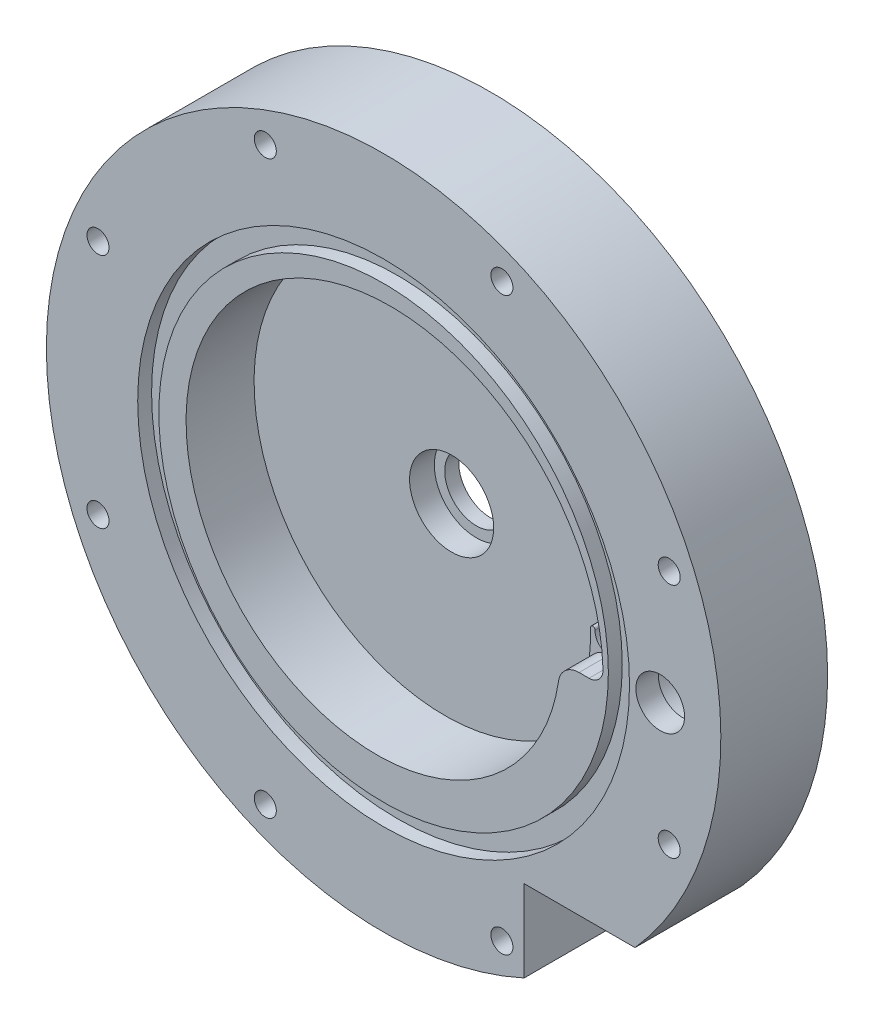
from build123d import *

# Parameters (mm, degrees)
VOLUTE_CUT_DEPTH         = 109.853225441
CAP_CUT_DEPTH            = 110.150134912
SKETCH28_W               = 25.046126628
SKETCH28_H               = 18.470321928
OUTLET_HOLE_CUT_DEPTH    = 111.431593896
OUTLET_PIPE_THREAD_D     = 14.2748
OUTLET_PIPE_THREAD_DEPTH = 12.7
OUTLET_PIPE_THREAD_TIP   = 4.288582582
SKETCH26_R               = 2.4892
FASTENER_HOLE_DEPTH      = 111.431593896
FASTENER_HOLES_COUNT     = 8
SKETCH16_R               = 55.5625
SKETCH16_R_2             = 50.7873
O_RING_GROOVE_DEPTH      = 3.1369
CIRPATTERN1_COUNT        = 8


with BuildPart() as part:
    # Sketch22 → Main Body (revolve)
    with BuildSketch(Plane(origin=(0, 0, 0), x_dir=(1, 0, 0), z_dir=(0, 1, 0))):
        Polygon((-25.4, 0), (-9.5, 0), (-9.5, 5.588), (-7.14375, 5.588), (-7.14375, 8.763), (-76.2, 8.763), (-76.2, -15.367), (-25.4, -15.367), align=None)
    revolve(axis=Axis((0, 0, 0), (0, 0, -1)))

    # Sketch23 → Volute Cut (cut, through all)
    with BuildSketch(Plane.XY):
        with BuildLine():
            Line((44.166924028, -3.278948669), (46.409987281, -3.278948669))
            ThreePointArc((46.409987281, -3.278948669), (48.689668065, -2.311613487), (49.577995098, 0))
            add(Edge.make_bspline(
                [(39.939526111, 0), (39.942269446, -0.0837473), (39.947756723, -0.251260409), (39.954015699, -0.502616311), (39.958818633, -0.754058522), (39.965227666, -1.257271925), (39.961619732, -2.517021244), (39.875091851, -4.365243066), (39.649454652, -6.542756078), (39.33988264, -8.543760179), (38.929454388, -10.530211789), (38.418824768, -12.497026639), (37.808911738, -14.439148731), (37.100892119, -16.351564673), (36.296198826, -18.22931668), (35.396517359, -20.067515799), (34.403782101, -21.86135476), (33.320172005, -23.606120692), (32.148105775, -25.297207577), (30.890236459, -26.930128476), (29.549445458, -28.500527466), (28.128835965, -30.00419128), (26.631725823, -31.437060619), (25.061639825, -32.795241099), (23.422301466, -34.075013818), (21.717624168, -35.272845505), (19.951701985, -36.385398236), (18.128799822, -37.409538673), (16.253343185, -38.342346824), (14.329907485, -39.18112428), (12.363206918, -39.923401923), (10.358082955, -40.566947066), (8.319492465, -41.109770024), (6.2524955, -41.550130082), (4.162242776, -41.886540847), (2.053962868, -42.117774975), (-0.06705083, -42.242868254), (-2.195453363, -42.261123016), (-4.325861655, -42.172110902), (-6.452868085, -41.975674931), (-8.57105419, -41.671930888), (-10.675004435, -41.261268029), (-12.759320026, -40.744349078), (-14.818632734, -40.12210953), (-16.847618693, -39.395756259), (-18.841012126, -38.56676542), (-20.793618979, -37.636879662), (-22.700330424, -36.608104648), (-24.556136184, -35.482704889), (-26.356137661, -34.263198905), (-28.095560825, -32.952353715), (-29.769768833, -31.55317868), (-31.374274336, -30.068918699), (-32.904751456, -28.503046779), (-34.357047394, -26.859256), (-35.727193628, -25.141450883), (-37.011416693, -23.353738194), (-38.206148494, -21.500417195), (-39.308036131, -19.585969367), (-40.313951213, -17.615047632), (-41.220998633, -15.592465105), (-42.026524769, -13.523183384), (-42.728125112, -11.412300433), (-43.323651272, -9.265038062), (-43.811217363, -7.086729057), (-44.189205737, -4.882803972), (-44.45627205, -2.658777629), (-44.611349658, -0.420235354), (-44.653653307, 1.827181013), (-44.582682128, 4.077787306), (-44.398221909, 6.325871377), (-44.100346646, 8.56570756), (-43.689419363, 10.791571224), (-43.166092199, 12.997753372), (-42.531305754, 15.17857525), (-41.786287694, 17.328402935), (-40.932550626, 19.441661853), (-39.971889229, 21.5128512), (-38.906376662, 23.536558227), (-37.738360243, 25.507472342), (-36.470456415, 27.420399009), (-35.105545007, 29.270273394), (-33.646762806, 31.052173728), (-32.097496441, 32.761334351), (-30.461374618, 34.393158406), (-28.742259697, 35.943230135), (-26.94423865, 37.407326771), (-25.071613414, 38.781429964), (-23.128890663, 40.061736735), (-21.120771014, 41.244669906), (-19.052137713, 42.326888003), (-16.928044805, 43.305294581), (-14.753704833, 44.177046957), (-12.534476089, 44.939564331), (-10.275849449, 45.590535256), (-7.983434825, 46.127924454), (-5.662947262, 46.549978947), (-3.32019273, 46.855233489), (-0.961053623, 47.042515279), (1.408525976, 47.110947946), (3.782555248, 47.059954789), (6.155011749, 46.889261268), (8.519856664, 46.598896718), (10.871050148, 46.189195315), (13.202566726, 45.660796242), (15.5084107, 45.014643097), (17.782631543, 44.251982509), (20.019339221, 43.374361984), (22.21271942, 42.383626969), (24.357048618, 41.281917146), (26.446708992, 40.07166197), (28.476203094, 38.755575441), (30.440168269, 37.336650139), (32.333390787, 35.818150527), (34.150819627, 34.203605534), (35.887579905, 32.496800442), (37.53898589, 30.70176809), (39.100553583, 28.822779415), (40.568012821, 26.864333353), (41.937318874, 24.831146131), (43.204663511, 22.728139958), (44.366485495, 20.560431162), (45.419480476, 18.333317788), (46.360610274, 16.052266689), (47.187111503, 13.722900146), (47.896503526, 11.35098205), (48.486595709, 8.942403666), (48.955493971, 6.503169041), (49.272698681, 4.245159804), (49.431000562, 2.592939581), (49.496684411, 1.660906774), (49.521980456, 1.24612125), (49.539009606, 0.934823446), (49.554044624, 0.6233596), (49.56726265, 0.311747828), (49.574417371, 0.103923043), (49.577995098, 0)],
                knots=[0, 0, 0, 0, 0.000895368, 0.001790933, 0.002686696, 0.003582656, 0.00716847, 0.016146863, 0.023343889, 0.030553689, 0.037776306, 0.045011781, 0.052260149, 0.059521445, 0.0667957, 0.074082946, 0.08138321, 0.088696521, 0.096022905, 0.103362389, 0.110714996, 0.11808075, 0.125459676, 0.132851796, 0.140257131, 0.147675704, 0.155107535, 0.162552646, 0.170011055, 0.177482784, 0.184967851, 0.192466275, 0.199978075, 0.207503269, 0.215041875, 0.222593912, 0.230159396, 0.237738345, 0.245330775, 0.252936704, 0.260556148, 0.268189123, 0.275835645, 0.28349573, 0.291169394, 0.298856653, 0.306557521, 0.314272014, 0.322000147, 0.329741934, 0.337497391, 0.345266532, 0.35304937, 0.360845922, 0.368656199, 0.376480218, 0.384317991, 0.392169531, 0.400034854, 0.407913972, 0.415806898, 0.423713647, 0.43163423, 0.439568662, 0.447516954, 0.455479121, 0.463455174, 0.471445127, 0.479448991, 0.48746678, 0.495498506, 0.503544181, 0.511603818, 0.519677428, 0.527765023, 0.535866616, 0.543982219, 0.552111843, 0.5602555, 0.568413202, 0.57658496, 0.584770787, 0.592970693, 0.60118469, 0.609412789, 0.617655002, 0.625911339, 0.634181813, 0.642466433, 0.650765212, 0.65907816, 0.667405288, 0.675746607, 0.684102128, 0.692471861, 0.700855818, 0.709254008, 0.717666443, 0.726093134, 0.734534089, 0.742989321, 0.75145884, 0.759942655, 0.768440778, 0.776953218, 0.785479986, 0.794021092, 0.802576546, 0.811146358, 0.819730538, 0.828329097, 0.836942043, 0.845569388, 0.854211141, 0.862867312, 0.87153791, 0.880222946, 0.888922429, 0.89763637, 0.906364776, 0.915107659, 0.923865028, 0.932636892, 0.94142326, 0.950224144, 0.959039551, 0.967869491, 0.976713973, 0.985573008, 0.992226839, 0.994446604, 0.995556828, 0.996667279, 0.997777958, 0.998888865, 1, 1, 1, 1], degree=3))
            ThreePointArc((39.939526111, 0), (40.466576111, 0.544597432), (40.993626111, 0))
            ThreePointArc((40.993626111, 0), (41.885404576, -2.31195546), (44.166924028, -3.278948669))
        make_face()
    extrude(amount=VOLUTE_CUT_DEPTH, mode=Mode.SUBTRACT)

    # Sketch25 → Cap Cut (cut, through all)
    with BuildSketch(Plane.XY.offset(8.58266)):
        with BuildLine():
            ThreePointArc((39.530232145, -7.279976568), (41.104770543, -4.417482526), (44.166924028, -3.278948669))
            ThreePointArc((44.166924028, -3.278948669), (41.885404576, -2.31195546), (40.993626111, 0))
            ThreePointArc((40.993626111, 0), (40.466576111, 0.544597432), (39.939526111, 0))
            add(Edge.make_bspline(
                [(39.530232145, -7.279976568), (39.566715351, -7.033442985), (39.69332497, -6.119385335), (39.875091851, -4.365243066), (39.961619732, -2.517021244), (39.965227666, -1.257271925), (39.958818633, -0.754058522), (39.954015699, -0.502616311), (39.947756723, -0.251260409), (39.942269446, -0.0837473), (39.939526111, 0)],
                knots=[0.973993066, 0.973993066, 0.973993066, 0.973993066, 0.976656111, 0.983853137, 0.99283153, 0.996417344, 0.997313304, 0.998209067, 0.999104632, 1, 1, 1, 1], degree=3))
        make_face()
    extrude(amount=CAP_CUT_DEPTH, mode=Mode.SUBTRACT)

    # Sketch28 → Outlet Hole Cut (cut, through all)
    with BuildSketch(Plane.XY.offset(15.367)):
        with Locations((44.273063314, -60.035160964)):
            Rectangle(SKETCH28_W, SKETCH28_H)
    extrude(amount=-OUTLET_HOLE_CUT_DEPTH, mode=Mode.SUBTRACT)

    # Sketch20 → Outlet Hole (revolve, cut)
    with BuildSketch(Plane(origin=(45.288455655, -50.8, 4.29133), x_dir=(0, 0, -1), z_dir=(1, 0, 0))):
        Polygon((0, 0), (0, 53.661598698), (4.7625, 50.8), (4.7625, 0), align=None)
    revolve(axis=Axis((45.288455655, -57.15, 4.29133), (0, 1, 0)), mode=Mode.SUBTRACT)

    # Outlet Pipe Thread
    with Locations(Plane(origin=(45.288455655, -50.8, 4.29133), x_dir=(0, 0, -1), z_dir=(0, -1, 0))):
        with Locations((0, 0)):
            Hole(OUTLET_PIPE_THREAD_D / 2, depth=OUTLET_PIPE_THREAD_DEPTH)
            with Locations((0, 0, -(OUTLET_PIPE_THREAD_DEPTH + OUTLET_PIPE_THREAD_TIP / 2))):  # 118° drill point
                Cone(0, OUTLET_PIPE_THREAD_D / 2, OUTLET_PIPE_THREAD_TIP, mode=Mode.SUBTRACT)

    # Sketch26 → Fastener Hole (cut, through all)
    with BuildSketch(Plane.XY.offset(15.367)):
        with Locations((64.532985346, -26.730437751)):
            Circle(SKETCH26_R)
    fastener_hole = extrude(amount=-FASTENER_HOLE_DEPTH, mode=Mode.SUBTRACT)

    # Fastener Holes: Fastener Hole ×8 about axis
    fastener_holes_axis = Axis((0, 0, 0), (0, 0, 1))
    for i in range(1, FASTENER_HOLES_COUNT):
        add(fastener_hole.rotate(fastener_holes_axis, i * 360 / FASTENER_HOLES_COUNT), mode=Mode.SUBTRACT)

    # Sketch16 → O-Ring Groove (cut)
    with BuildSketch(Plane.XY.offset(15.367)):
        Circle(SKETCH16_R)
        Circle(SKETCH16_R_2, mode=Mode.SUBTRACT)
    extrude(amount=-O_RING_GROOVE_DEPTH, mode=Mode.SUBTRACT)

    # Sketch27 → Turbine Shaft Hole (revolve, cut)
    with BuildSketch(Plane.ZX):
        Polygon((15.367, 62.5), (-8.763, 62.5), (-8.763, 51.324), (3.937, 51.324), (3.937, 54.5625), (10.287, 54.5625), (10.287, 57), (15.367, 57), align=None)
    revolve(axis=Axis((62.5, 0, 15.367), (0, 0, -1)), mode=Mode.SUBTRACT)

    # Sketch30 → Tap Drill for #10-32 Tap1 (revolve, cut)
    with BuildSketch(Plane(origin=(52.799715283, 21.87035816, -8.763), x_dir=(0, 1, 0), z_dir=(1, 0, 0))):
        Polygon((0, 0), (0, 13.913317848), (2.0193, 12.7), (2.0193, 0), align=None)
    tap_drill_for_10_32_tap1 = revolve(axis=Axis((52.799715283, 21.87035816, -15.113), (0, 0, 1)), mode=Mode.SUBTRACT)

    # CirPattern1: Tap Drill for #10-32 Tap1 ×8 about axis
    cirpattern1_axis = Axis((0, 0, 0), (0, 0, 1))
    for i in range(1, CIRPATTERN1_COUNT):
        add(tap_drill_for_10_32_tap1.rotate(cirpattern1_axis, i * 360 / CIRPATTERN1_COUNT), mode=Mode.SUBTRACT)


solid = part.part
